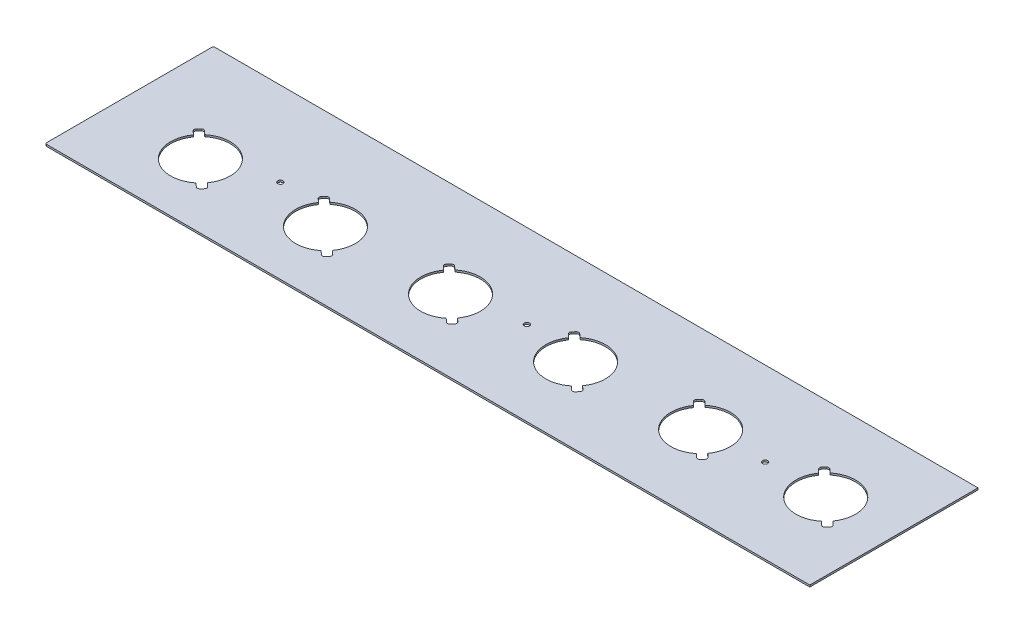
from build123d import *

# Parameters (mm, degrees)
SKETCH2_W             = 635
SKETCH2_H             = 139.7
BOSS_EXTRUDE1_DEPTH   = 1.524
FILLET1_R             = 1.27
F_8_CLEARANCE_HOLE1_D = 4.3053


with BuildPart() as part:
    # Sketch2 → Boss-Extrude1 (new body)
    with BuildSketch(Plane(origin=(0, 0, 0), x_dir=(1, 0, 0), z_dir=(0, 1, 0))):
        Rectangle(SKETCH2_W, SKETCH2_H)
        with BuildLine():
            Line((180.472660206, -17.567929311), (183.419540912, -20.329237517))
            ThreePointArc((183.419540912, -20.329237517), (184.050969665, -21.723670548), (183.511444167, -23.156171155))
            Line((183.511444167, -23.156171155), (181.665298658, -25.126386057))
            ThreePointArc((181.665298658, -25.126386057), (180.270865627, -25.757814811), (178.838365021, -25.218289312))
            Line((178.838365021, -25.218289312), (175.891484315, -22.456981107))
            ThreePointArc((175.891484315, -22.456981107), (143.415815963, -21.304076794), (140.156015662, 11.02813509))
            Line((140.156015662, 11.02813509), (137.209134957, 13.789443295))
            ThreePointArc((137.209134957, 13.789443295), (136.577706203, 15.183876327), (137.117231702, 16.616376933))
            Line((137.117231702, 16.616376933), (138.96337721, 18.586591835))
            ThreePointArc((138.96337721, 18.586591835), (140.357810242, 19.218020589), (141.790310848, 18.67849509))
            Line((141.790310848, 18.67849509), (144.737191553, 15.917186885))
            ThreePointArc((144.737191553, 15.917186885), (177.212859905, 14.764282572), (180.472660206, -17.567929311))
        make_face(mode=Mode.SUBTRACT)
        with BuildLine():
            Line((242.371972914, 21.948392201), (245.318853619, 19.187083996))
            ThreePointArc((245.318853619, 19.187083996), (277.794521971, 18.034179683), (281.054322272, -14.2980322))
            Line((281.054322272, -14.2980322), (284.001202977, -17.059340406))
            ThreePointArc((284.001202977, -17.059340406), (284.632631731, -18.453773438), (284.093106232, -19.886274044))
            Line((284.093106232, -19.886274044), (282.246960724, -21.856488946))
            ThreePointArc((282.246960724, -21.856488946), (280.852527693, -22.4879177), (279.420027086, -21.948392201))
            Line((279.420027086, -21.948392201), (276.473146381, -19.187083996))
            ThreePointArc((276.473146381, -19.187083996), (243.997478029, -18.034179683), (240.737677728, 14.2980322))
            Line((240.737677728, 14.2980322), (237.790797023, 17.059340406))
            ThreePointArc((237.790797023, 17.059340406), (237.159368269, 18.453773438), (237.698893768, 19.886274044))
            Line((237.698893768, 19.886274044), (239.545039276, 21.856488946))
            ThreePointArc((239.545039276, 21.856488946), (240.939472307, 22.4879177), (242.371972914, 21.948392201))
        make_face(mode=Mode.SUBTRACT)
        with BuildLine():
            Line((39.574353596, 7.758237979), (36.627472891, 10.519546184))
            ThreePointArc((36.627472891, 10.519546184), (35.996044137, 11.913979216), (36.535569636, 13.346479822))
            Line((36.535569636, 13.346479822), (38.381715144, 15.316694724))
            ThreePointArc((38.381715144, 15.316694724), (39.776148176, 15.948123478), (41.208648782, 15.408597979))
            Line((41.208648782, 15.408597979), (44.155529487, 12.647289774))
            ThreePointArc((44.155529487, 12.647289774), (76.631197839, 11.494385461), (79.890998141, -20.837826422))
            Line((79.890998141, -20.837826422), (82.837878846, -23.599134628))
            ThreePointArc((82.837878846, -23.599134628), (83.4693076, -24.993567659), (82.929782101, -26.426068266))
            Line((82.929782101, -26.426068266), (81.083636592, -28.396283168))
            ThreePointArc((81.083636592, -28.396283168), (79.689203561, -29.027711922), (78.256702955, -28.488186423))
            Line((78.256702955, -28.488186423), (75.30982225, -25.726878217))
            ThreePointArc((75.30982225, -25.726878217), (42.834153897, -24.573973905), (39.574353596, 7.758237979))
        make_face(mode=Mode.SUBTRACT)
        with BuildLine():
            Line((-61.00730847, 4.488340868), (-63.954189175, 7.249649073))
            ThreePointArc((-63.954189175, 7.249649073), (-64.585617929, 8.644082105), (-64.04609243, 10.076582711))
            Line((-64.04609243, 10.076582711), (-62.199946921, 12.046797614))
            ThreePointArc((-62.199946921, 12.046797614), (-60.80551389, 12.678226367), (-59.373013284, 12.138700869))
            Line((-59.373013284, 12.138700869), (-56.426132579, 9.377392663))
            ThreePointArc((-56.426132579, 9.377392663), (-23.950464227, 8.22448835), (-20.690663925, -24.107723533))
            Line((-20.690663925, -24.107723533), (-17.74378322, -26.869031739))
            ThreePointArc((-17.74378322, -26.869031739), (-17.112354466, -28.26346477), (-17.651879965, -29.695965376))
            Line((-17.651879965, -29.695965376), (-19.498025473, -31.666180279))
            ThreePointArc((-19.498025473, -31.666180279), (-20.892458505, -32.297609033), (-22.324959111, -31.758083534))
            Line((-22.324959111, -31.758083534), (-25.271839816, -28.996775328))
            ThreePointArc((-25.271839816, -28.996775328), (-57.747508168, -27.843871016), (-61.00730847, 4.488340868))
        make_face(mode=Mode.SUBTRACT)
        with BuildLine():
            Line((-161.588970536, 1.218443757), (-164.535851241, 3.979751963))
            ThreePointArc((-164.535851241, 3.979751963), (-165.167279994, 5.374184994), (-164.627754496, 6.8066856))
            Line((-164.627754496, 6.8066856), (-162.781608987, 8.776900503))
            ThreePointArc((-162.781608987, 8.776900503), (-161.387175956, 9.408329256), (-159.95467535, 8.868803758))
            Line((-159.95467535, 8.868803758), (-157.007794645, 6.107495552))
            ThreePointArc((-157.007794645, 6.107495552), (-124.532126292, 4.954591239), (-121.272325991, -27.377620644))
            Line((-121.272325991, -27.377620644), (-118.325445286, -30.13892885))
            ThreePointArc((-118.325445286, -30.13892885), (-117.694016532, -31.533361881), (-118.233542031, -32.965862487))
            Line((-118.233542031, -32.965862487), (-120.079687539, -34.93607739))
            ThreePointArc((-120.079687539, -34.93607739), (-121.474120571, -35.567506144), (-122.906621177, -35.027980645))
            Line((-122.906621177, -35.027980645), (-125.853501882, -32.266672439))
            ThreePointArc((-125.853501882, -32.266672439), (-158.329170234, -31.113768127), (-161.588970536, 1.218443757))
        make_face(mode=Mode.SUBTRACT)
        with BuildLine():
            Line((-221.853988057, -30.647517755), (-218.907107352, -33.408825961))
            ThreePointArc((-218.907107352, -33.408825961), (-218.275678598, -34.803258992), (-218.815204097, -36.235759598))
            Line((-218.815204097, -36.235759598), (-220.661349605, -38.205974501))
            ThreePointArc((-220.661349605, -38.205974501), (-222.055782637, -38.837403255), (-223.488283243, -38.297877756))
            Line((-223.488283243, -38.297877756), (-226.435163948, -35.53656955))
            ThreePointArc((-226.435163948, -35.53656955), (-258.9108323, -34.383665237), (-262.170632601, -2.051453354))
            Line((-262.170632601, -2.051453354), (-265.117513306, 0.709854852))
            ThreePointArc((-265.117513306, 0.709854852), (-265.74894206, 2.104287883), (-265.209416561, 3.536788489))
            Line((-265.209416561, 3.536788489), (-263.363271053, 5.507003392))
            ThreePointArc((-263.363271053, 5.507003392), (-261.968838022, 6.138432146), (-260.536337415, 5.598906647))
            Line((-260.536337415, 5.598906647), (-257.58945671, 2.837598441))
            ThreePointArc((-257.58945671, 2.837598441), (-225.113788358, 1.684694129), (-221.853988057, -30.647517755))
        make_face(mode=Mode.SUBTRACT)
    extrude(amount=BOSS_EXTRUDE1_DEPTH)

    # Fillet1
    fillet1_edges = [part.edges().sort_by_distance(p)[0] for p in [
        (-317.5, 0.762, 69.85),
        (-317.5, 0.762, -69.85),
    ]]
    fillet(fillet1_edges, radius=FILLET1_R)

    # #8 Clearance Hole1 (through all)
    with Locations(Plane(origin=(0, 1.524, 0), x_dir=(1, 0, 0), z_dir=(0, 1, 0))):
        with Locations((210.5786, 0), (12.7, 0), (-191.9606, 0)):
            Hole(F_8_CLEARANCE_HOLE1_D / 2)


solid = part.part
